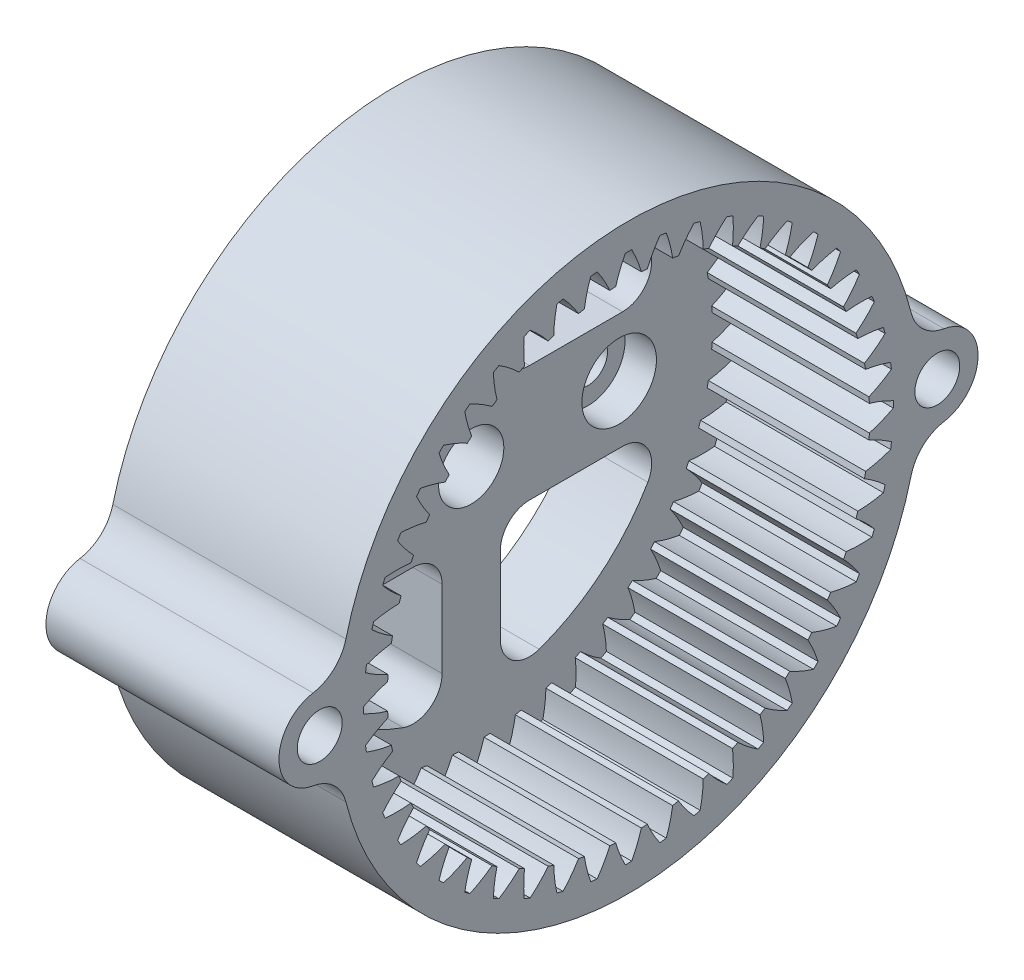
from build123d import *

# Parameters (mm, degrees)
BASPROSKE_W         = 13.5
BASPROSKE_H         = 4.3
TOOTHCUT_DEPTH      = 38.84507894
TEETHCUTS_COUNT     = 48
TEETHCUTS_ANGLE     = 352.5
SKETCH1_R           = 25
SKETCH1_R_2         = 2.8
SKETCH1_R_3         = 3.2
BOSS_EXTRUDE1_DEPTH = 2.7
SKETCH2_R           = 25
SKETCH2_R_2         = 2.8
SKETCH2_R_3         = 1.7
BOSS_EXTRUDE2_DEPTH = 3.8
BOSS_EXTRUDE3_DEPTH = 20
SKETCH5_R           = 1.925
CUT_EXTRUDE2_DEPTH  = 5.5
FILLET2_R           = 3.5
CUT_EXTRUDE3_DEPTH  = 42.318881882


with BuildPart() as part:
    # BasProSke → Base-Revolve (revolve)
    with BuildSketch(Plane(origin=(0, 0, 0), x_dir=(1, 0, 0), z_dir=(0, 1, 0)), mode=Mode.PRIVATE) as base_revolve_sk:
        with Locations((6.75, 22.85)):
            Rectangle(BASPROSKE_W, BASPROSKE_H)
    revolve(base_revolve_sk.sketch.rotate(Axis((-10, 0, 0), (1, 0, 0)), 180), axis=Axis((-10, 0, 0), (1, 0, 0)))

    # TooCutSke → ToothCut (cut, through all)
    with BuildSketch(Plane(origin=(0, 0, 0), x_dir=(0, 0, -1), z_dir=(1, 0, 0))):
        with BuildLine():
            ThreePointArc((1.105765849, 20.645008284), (0.744300498, 21.706268959), (0.274763595, 22.724338956))
            ThreePointArc((0.274763595, 22.724338956), (0, 22.726), (-0.274763595, 22.724338956))
            ThreePointArc((-0.274763595, 22.724338956), (-0.744300498, 21.706268959), (-1.105765849, 20.645008284))
            ThreePointArc((-1.105765849, 20.645008284), (0, 20.6746), (1.105765849, 20.645008284))
        make_face()
    toothcut = extrude(amount=TOOTHCUT_DEPTH, mode=Mode.SUBTRACT)

    # TeethCuts: ToothCut ×48 about axis
    teethcuts_axis = Axis((-10, 0, 0), (1, 0, 0))
    for i in range(1, TEETHCUTS_COUNT):
        add(toothcut.rotate(teethcuts_axis, i * TEETHCUTS_ANGLE / (TEETHCUTS_COUNT - 1)), mode=Mode.SUBTRACT)

    # Sketch1 → Boss-Extrude1 (add)
    with BuildSketch(Plane.ZY):
        Circle(SKETCH1_R)
        with Locations(Location((0, 0, 0), (0, 0, 180))):
            Circle(SKETCH1_R_2, mode=Mode.SUBTRACT)
        with Locations(Location((-12.7, 0, 0), (0, 0, 180))):
            Circle(SKETCH1_R_3, mode=Mode.SUBTRACT)
        with Locations(Location((12.7, 0, 0), (0, 0, 180))):
            Circle(SKETCH1_R_3, mode=Mode.SUBTRACT)
    extrude(amount=BOSS_EXTRUDE1_DEPTH)

    # Sketch2 → Boss-Extrude2 (add)
    with BuildSketch(Plane.ZY.offset(2.7)):
        Circle(SKETCH2_R)
        with Locations(Location((0, 0, 0), (0, 0, 180))):
            Circle(SKETCH2_R_2, mode=Mode.SUBTRACT)
        with Locations(Location((-12.7, 0, 0), (0, 0, 180))):
            Circle(SKETCH2_R_3, mode=Mode.SUBTRACT)
        with Locations(Location((12.7, 0, 0), (0, 0, 180))):
            Circle(SKETCH2_R_3, mode=Mode.SUBTRACT)
    extrude(amount=BOSS_EXTRUDE2_DEPTH)

    # Sketch4 → Boss-Extrude3 (add)
    with BuildSketch(Plane(origin=(13.5, 0, 0), x_dir=(0, 0, -1), z_dir=(1, 0, 0))):
        with BuildLine():
            Line((-26.5, -3.5), (-24.753787589, -3.5))
            ThreePointArc((-24.753787589, -3.5), (-25, 0), (-24.753787589, 3.5))
            Line((-24.753787589, 3.5), (-26.5, 3.5))
            ThreePointArc((-26.5, 3.5), (-30, 0), (-26.5, -3.5))
        make_face()
        with BuildLine():
            Line((26.5, -3.5), (24.753787589, -3.5))
            ThreePointArc((24.753787589, -3.5), (25, 0), (24.753787589, 3.5))
            Line((24.753787589, 3.5), (26.5, 3.5))
            ThreePointArc((26.5, 3.5), (30, 0), (26.5, -3.5))
        make_face()
    extrude(amount=-BOSS_EXTRUDE3_DEPTH)

    # Sketch5 → Cut-Extrude2 (cut)
    with BuildSketch(Plane(origin=(13.5, 0, 0), x_dir=(0, 0, -1), z_dir=(1, 0, 0))):
        with Locations((26.5, 0)):
            Circle(SKETCH5_R)
        with Locations((-26.5, 0)):
            Circle(SKETCH5_R)
    extrude(amount=-CUT_EXTRUDE2_DEPTH, mode=Mode.SUBTRACT)

    # Fillet2
    # the kernel refuses this fillet: 3.5 mm, written as the material it adds along each edge
    with BuildSketch(Plane(origin=(13.5, 3.5, -24.753787589), x_dir=(0, -0.020512603436266975, -0.999789594414878), z_dir=(-1, 0, 0))) as fillet2_piece_1:
        with BuildLine():
            CenterArc((2.826706304, -3.463444218), FILLET2_R, 98.288202898, 66.515795179)
            Line((-0.550915452, -2.546017779), (-0.888677628, -2.454275136))
            ThreePointArc((-0.888677628, -2.454275136), (-0.584357226, -1.20616823), (-0.345474992, 0.056098395))
            Line((-0.345474992, 0.056098395), (0.007179411, 0.349926358))
            ThreePointArc((0.007179411, 0.349926358), (1.753024409, 0.314106995), (2.271719348, 0.346344422))
            Line((2.271719348, 0.346344422), (2.322172707, 0))
        make_face()
    extrude(amount=20)
    with BuildSketch(Plane(origin=(13.5, -3.5, -24.753787589), x_dir=(0, -0.9815129803575946, 0.19139558351631877), z_dir=(-1, 0, 0))) as fillet2_piece_2:
        with BuildLine():
            CenterArc((2.787286204, -3.495246772), FILLET2_R, 92.986393818, 66.515795179)
            Line((-0.491113286, -2.269646189), (-0.818953234, -2.147086131))
            ThreePointArc((-0.818953234, -2.147086131), (-0.677746886, -1.646941694), (-0.343529543, 0.066988454))
            Line((-0.343529543, 0.066988454), (0.018234583, 0.349524677))
            ThreePointArc((0.018234583, 0.349524677), (1.302470189, 0.316048374), (2.586705795, 0.349524677))
            Line((2.586705795, 0.349524677), (2.604940377, 0))
        make_face()
    extrude(amount=20)
    with BuildSketch(Plane(origin=(13.5, -3.5, 24.753787589), x_dir=(0, -0.981512980357595, -0.19139558351631633), z_dir=(-1, 0, 0))) as fillet2_piece_3:
        with BuildLine():
            CenterArc((2.787286204, 3.495246772), FILLET2_R, 200.497811003, 66.515795179)
            Line((-0.491113286, 2.269646189), (-0.818953234, 2.147086131))
            ThreePointArc((-0.818953234, 2.147086131), (-0.677746886, 1.646941694), (-0.343529543, -0.066988454))
            Line((-0.343529543, -0.066988454), (0.018234583, -0.349524677))
            ThreePointArc((0.018234583, -0.349524677), (1.302470189, -0.316048374), (2.586705795, -0.349524677))
            Line((2.586705795, -0.349524677), (2.604940377, 0))
        make_face()
    extrude(amount=20)
    with BuildSketch(Plane(origin=(13.5, 3.5, 24.753787589), x_dir=(0, -0.020512603436267516, 0.999789594414878), z_dir=(-1, 0, 0))) as fillet2_piece_4:
        with BuildLine():
            CenterArc((2.826706304, 3.463444218), FILLET2_R, 195.196001923, 66.515795179)
            Line((-0.550915452, 2.546017779), (-0.888677628, 2.454275136))
            ThreePointArc((-0.888677628, 2.454275136), (-0.584357226, 1.20616823), (-0.345474992, -0.056098395))
            Line((-0.345474992, -0.056098395), (0.007179411, -0.349926358))
            ThreePointArc((0.007179411, -0.349926358), (1.753024409, -0.314106995), (2.271719348, -0.346344422))
            Line((2.271719348, -0.346344422), (2.322172707, 0))
        make_face()
    extrude(amount=20)
    # the kernel refuses this fillet: 3.5 mm, written as the material it takes off along each edge

    # Sketch7 → Cut-Extrude3 (cut, through all)
    with BuildSketch(Plane(origin=(0, 0, 0), x_dir=(0, 0, -1), z_dir=(1, 0, 0))):
        with BuildLine():
            Line((-12.990381057, -5), (-5, -5))
            ThreePointArc((-5, -5), (-3.232233047, -5.732233047), (-2.5, -7.5))
            Line((-2.5, -7.5), (-2.5, -14.142135624))
            ThreePointArc((-2.5, -14.142135624), (-3.556624327, -16.183377076), (-5.833333333, -16.499158228))
            ThreePointArc((-5.833333333, -16.499158228), (-11.186803062, -13.457542022), (-15.155444566, -8.75))
            ThreePointArc((-15.155444566, -8.75), (-15.155444566, -6.25), (-12.990381057, -5))
        make_face()
        with BuildLine():
            Line((12.990381057, -5), (5, -5))
            ThreePointArc((5, -5), (3.232233047, -5.732233047), (2.5, -7.5))
            Line((2.5, -7.5), (2.5, -14.142135624))
            ThreePointArc((2.5, -14.142135624), (3.556624327, -16.183377076), (5.833333333, -16.499158228))
            ThreePointArc((5.833333333, -16.499158228), (11.186803062, -13.457542022), (15.155444566, -8.75))
            ThreePointArc((15.155444566, -8.75), (15.155444566, -6.25), (12.990381057, -5))
        make_face()
        with BuildLine():
            Line((12.990381057, 5), (5, 5))
            ThreePointArc((5, 5), (3.232233047, 5.732233047), (2.5, 7.5))
            Line((2.5, 7.5), (2.5, 14.142135624))
            ThreePointArc((2.5, 14.142135624), (3.556624327, 16.183377076), (5.833333333, 16.499158228))
            ThreePointArc((5.833333333, 16.499158228), (11.186803062, 13.457542022), (15.155444566, 8.75))
            ThreePointArc((15.155444566, 8.75), (15.155444566, 6.25), (12.990381057, 5))
        make_face()
        with BuildLine():
            Line((-12.990381057, 5), (-5, 5))
            ThreePointArc((-5, 5), (-3.232233047, 5.732233047), (-2.5, 7.5))
            Line((-2.5, 7.5), (-2.5, 14.142135624))
            ThreePointArc((-2.5, 14.142135624), (-3.556624327, 16.183377076), (-5.833333333, 16.499158228))
            ThreePointArc((-5.833333333, 16.499158228), (-11.186803062, 13.457542022), (-15.155444566, 8.75))
            ThreePointArc((-15.155444566, 8.75), (-15.155444566, 6.25), (-12.990381057, 5))
        make_face()
    extrude(amount=-CUT_EXTRUDE3_DEPTH, mode=Mode.SUBTRACT)


solid = part.part
